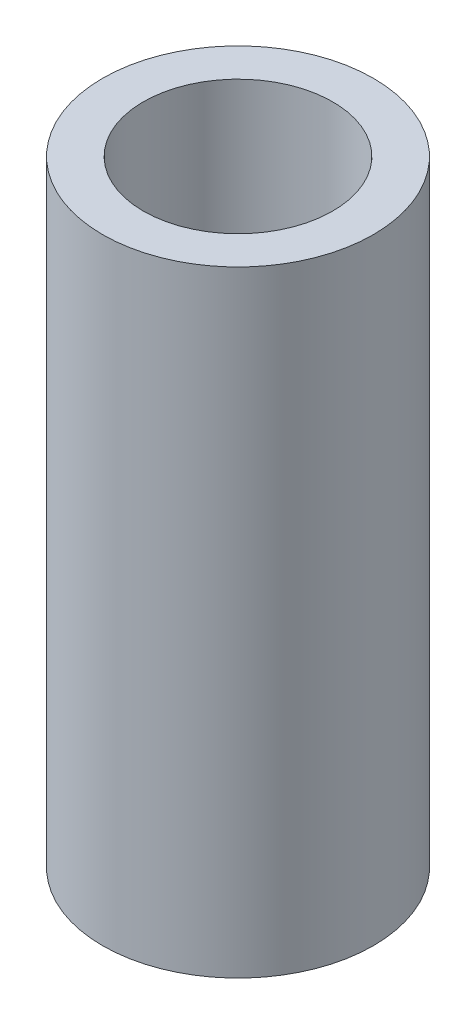
from build123d import *

# Parameters (mm, degrees)
SKETCH1_R           = 25
BOSS_EXTRUDE1_DEPTH = 113.704206256
SKETCH2_R           = 17.483646096
CUT_EXTRUDE1_DEPTH  = 120.074121959


with BuildPart() as part:
    # Sketch1 → Boss-Extrude1 (new body)
    with BuildSketch(Plane(origin=(0, 0, 0), x_dir=(1, 0, 0), z_dir=(0, 1, 0))):
        Circle(SKETCH1_R)
    extrude(amount=BOSS_EXTRUDE1_DEPTH)

    # Sketch2 → Cut-Extrude1 (cut, through all)
    with BuildSketch(Plane(origin=(0, 0, 0), x_dir=(1, 0, 0), z_dir=(0, 1, 0))):
        Circle(SKETCH2_R)
    extrude(amount=CUT_EXTRUDE1_DEPTH, mode=Mode.SUBTRACT)


solid = part.part
